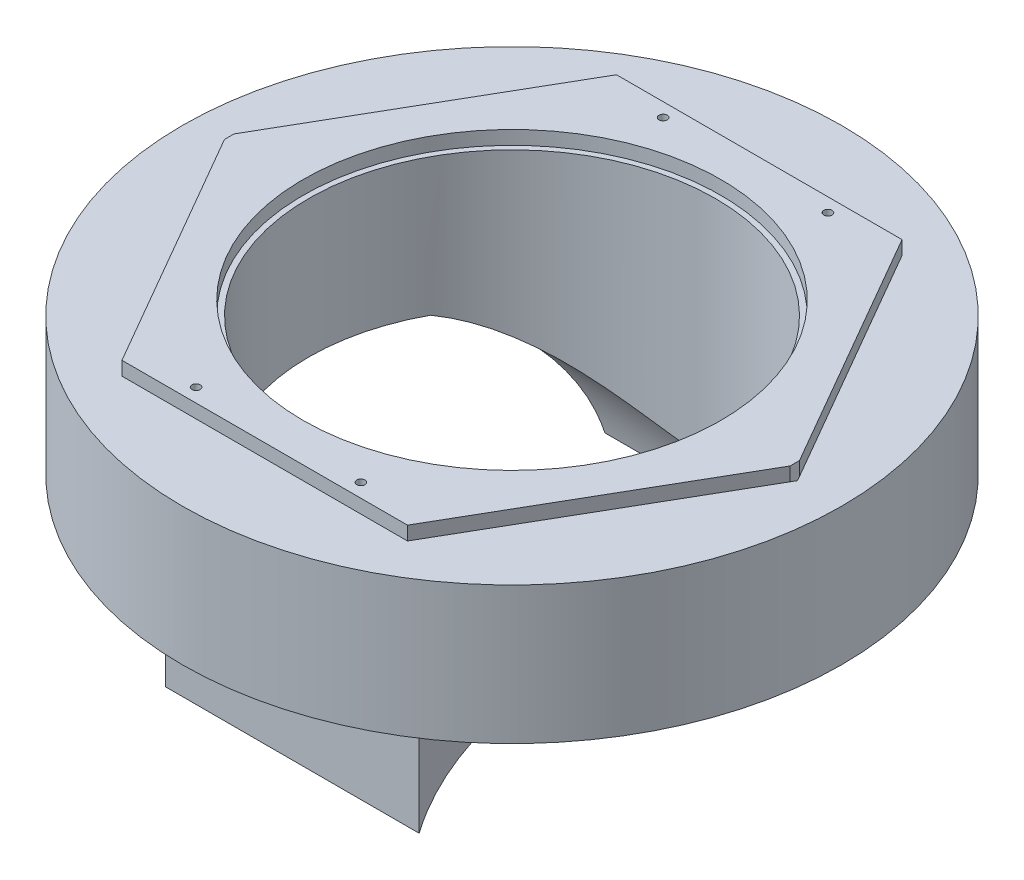
from build123d import *

# Parameters (mm, degrees)
SKETCH1_R           = 76
SKETCH1_R_2         = 1.5
BOSS_EXTRUDE1_DEPTH = 5
SKETCH2_R           = 120
SKETCH2_R_2         = 74
BOSS_EXTRUDE2_DEPTH = 50
BOSS_EXTRUDE3_DEPTH = 50
CUT_EXTRUDE2_DEPTH  = 10
CUT_EXTRUDE3_DEPTH  = 211


with BuildPart() as part:
    # Sketch1 → Boss-Extrude1 (new body)
    with BuildSketch(Plane(origin=(0, 0, 0), x_dir=(1, 0, 0), z_dir=(0, 1, 0))):
        Polygon((103.923048454, 0), (51.961524227, 90), (-51.961524227, 90), (-103.923048454, 0), (-51.961524227, -90), (51.961524227, -90), align=None)
        Circle(SKETCH1_R, mode=Mode.SUBTRACT)
        with Locations((30, 85)):
            Circle(SKETCH1_R_2, mode=Mode.SUBTRACT)
        with Locations((-30, 85)):
            Circle(SKETCH1_R_2, mode=Mode.SUBTRACT)
        with Locations((30, -85)):
            Circle(SKETCH1_R_2, mode=Mode.SUBTRACT)
        with Locations((-30, -85)):
            Circle(SKETCH1_R_2, mode=Mode.SUBTRACT)
    extrude(amount=BOSS_EXTRUDE1_DEPTH)

    # Sketch2 → Boss-Extrude2 (add)
    with BuildSketch(Plane.XZ):
        Circle(SKETCH2_R)
        Circle(SKETCH2_R_2, mode=Mode.SUBTRACT)
    extrude(amount=BOSS_EXTRUDE2_DEPTH)

    # Sketch3 → Boss-Extrude3 (add)
    with BuildSketch(Plane.XZ.offset(50)):
        with BuildLine():
            ThreePointArc((-65, 35.369478368), (0, 74), (65, 35.369478368))
            Line((65, 35.369478368), (65, 47.416697508))
            Line((65, 47.416697508), (46.188021535, 80))
            Line((46.188021535, 80), (-46.188021535, 80))
            Line((-46.188021535, 80), (-65, 47.416697508))
            Line((-65, 47.416697508), (-65, 35.369478368))
        make_face()
        with BuildLine():
            ThreePointArc((65, -35.369478368), (0, -74), (-65, -35.369478368))
            Line((-65, -35.369478368), (-65, -47.416697508))
            Line((-65, -47.416697508), (-46.188021535, -80))
            Line((-46.188021535, -80), (46.188021535, -80))
            Line((46.188021535, -80), (65, -47.416697508))
            Line((65, -47.416697508), (65, -35.369478368))
        make_face()
    extrude(amount=BOSS_EXTRUDE3_DEPTH)

    # Sketch4 → Cut-Extrude2 (cut)
    with BuildSketch(Plane(origin=(0, 5, 0), x_dir=(1, 0, 0), z_dir=(0, 1, 0))):
        Polygon((-102.923048454, 1.732050808), (-103.923048454, 0), (-102.923048454, -1.732050808), align=None)
        Polygon((102.923048454, -1.732050808), (103.923048454, 0), (102.923048454, 1.732050808), align=None)
    extrude(amount=-CUT_EXTRUDE2_DEPTH, mode=Mode.SUBTRACT)

    # Sketch5 → Cut-Extrude3 (cut)
    with BuildSketch(Plane(origin=(102.923048454, 0, 0), x_dir=(0, 0, -1), z_dir=(1, 0, 0))):
        with BuildLine():
            Line((-35.369478368, -50), (35.369478368, -50))
            ThreePointArc((35.369478368, -50), (64.057663407, -69.311461352), (80, -100))
            Line((80, -100), (-80, -100))
            ThreePointArc((-80, -100), (-64.057663407, -69.311461352), (-35.369478368, -50))
        make_face()
    extrude(amount=-CUT_EXTRUDE3_DEPTH, mode=Mode.SUBTRACT)


solid = part.part
